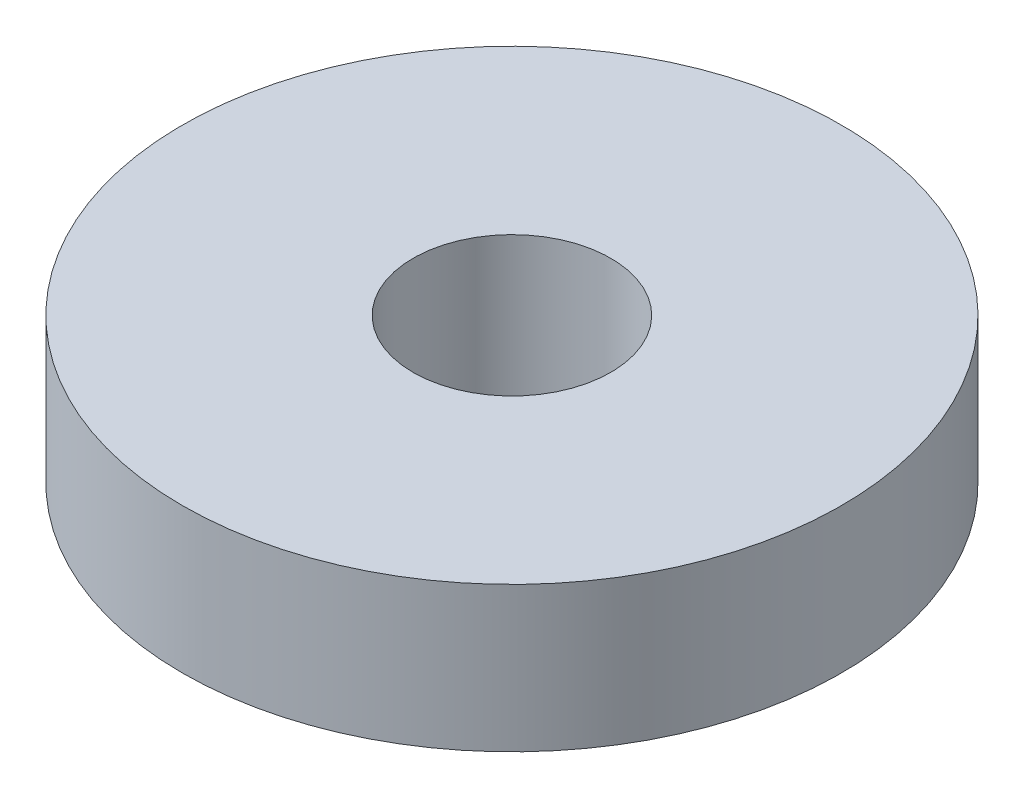
from build123d import *

# Parameters (mm, degrees)
SKETCH1_R           = 50
BOSS_EXTRUDE1_DEPTH = 22
SKETCH2_R           = 15
CUT_EXTRUDE1_DEPTH  = 75.054034326


with BuildPart() as part:
    # Sketch1 → Boss-Extrude1 (new body)
    with BuildSketch(Plane(origin=(0, 0, 0), x_dir=(1, 0, 0), z_dir=(0, 1, 0))):
        Circle(SKETCH1_R)
    extrude(amount=BOSS_EXTRUDE1_DEPTH)

    # Sketch2 → Cut-Extrude1 (cut, through all)
    with BuildSketch(Plane(origin=(0, 0, 0), x_dir=(1, 0, 0), z_dir=(0, 1, 0))):
        Circle(SKETCH2_R)
    extrude(amount=CUT_EXTRUDE1_DEPTH, mode=Mode.SUBTRACT)


solid = part.part
